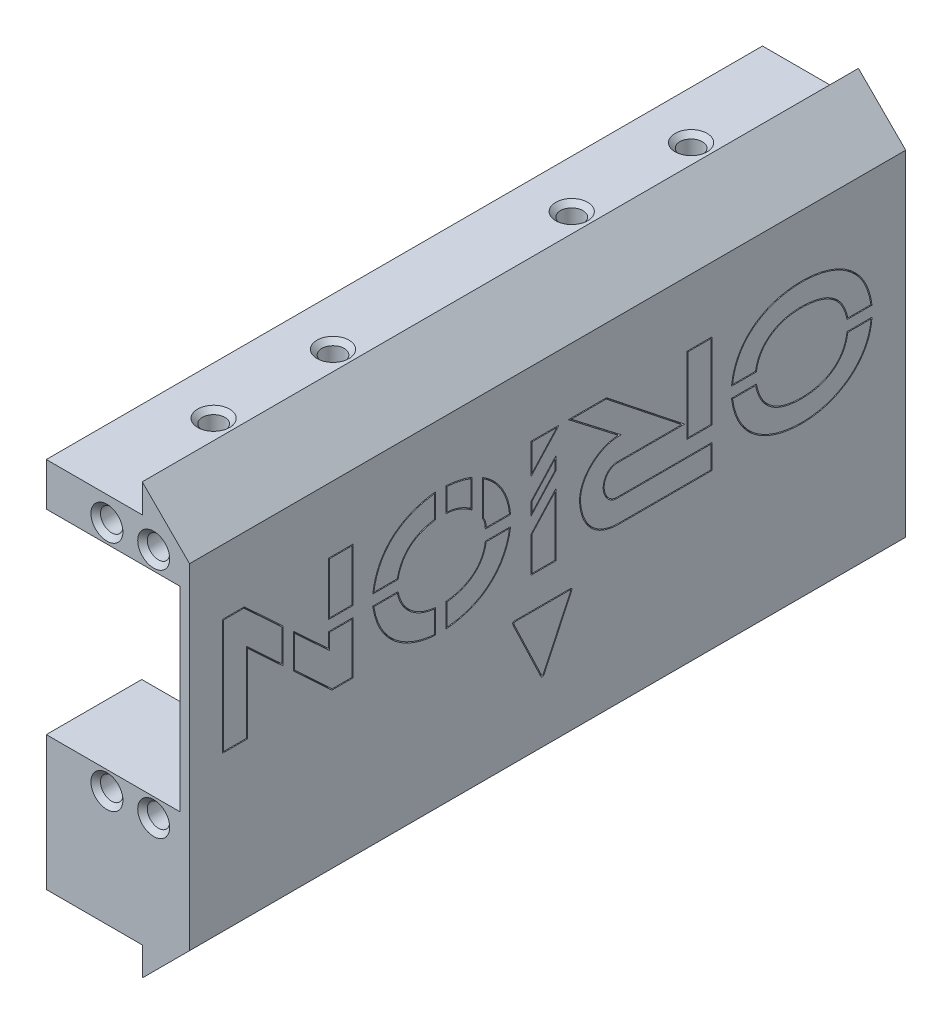
from build123d import *

# Parameters (mm, degrees)
BOSS_EXTRUDE1_DEPTH = 150
SKETCH2_R           = 2.35
CUT_EXTRUDE1_DEPTH  = 8
CUT_EXTRUDE2_START  = -8
SKETCH3_R           = 2.35
CUT_EXTRUDE2_DEPTH  = 8
CHAMFER1_SIZE       = 1
SKETCH4_W           = 20.1
SKETCH4_H           = 6
CUT_EXTRUDE3_DEPTH  = 158.321327226
CHAMFER2_SIZE       = 9.9
SKETCH5_R           = 2.35
CUT_EXTRUDE4_DEPTH  = 8
CHAMFER3_SIZE       = 1
SKETCH6_R           = 6.1
CUT_EXTRUDE5_DEPTH  = 3.2
SKETCH8_W           = 110
SKETCH8_H           = 21.9
CUT_EXTRUDE7_DEPTH  = 28
FILLET1_R           = 0.2
SKETCH9_W           = 80
SKETCH9_H           = 62.8
BOSS_EXTRUDE2_DEPTH = 1.5
SKETCH14_W          = 5.239877573
SKETCH14_H          = 15.985748595
SKETCH14_W_2        = 5.162010056
SKETCH14_H_2        = 11.128808668
CUT_EXTRUDE8_DEPTH  = 1
SKETCH15_W          = 4.762010056
SKETCH15_H          = 10.728808668
SKETCH15_W_2        = 4.839877573
SKETCH15_H_2        = 15.585748595
BOSS_EXTRUDE3_DEPTH = 1


with BuildPart() as part:
    # Sketch1 → Boss-Extrude1 (new body)
    with BuildSketch(Plane.XY):
        Polygon((-15, 45), (15, 45), (15, -45), (-15, -45), (-15, -10.9), (13, -10.9), (13, 30), (-15, 30), align=None)
    extrude(amount=BOSS_EXTRUDE1_DEPTH)

    # Sketch2 → Cut-Extrude1 (cut)
    with BuildSketch(Plane.XY.offset(150)):
        with Locations((7.5, 33.89)):
            Circle(SKETCH2_R)
        with Locations(Location((-2.3, 33.89, 0), (0, 0, 180))):
            Circle(SKETCH2_R)
        with Locations(Location((7.5, -14.79, 0), (0, 0, 180))):
            Circle(SKETCH2_R)
        with Locations((-2.3, -14.79)):
            Circle(SKETCH2_R)
    extrude(amount=-CUT_EXTRUDE1_DEPTH, mode=Mode.SUBTRACT)

    # Sketch3 → Cut-Extrude2 (cut)
    with BuildSketch(Plane(origin=(0, 0, 0), x_dir=(-1, 0, 0), z_dir=(0, 0, -1)).offset(CUT_EXTRUDE2_START)):
        with Locations(Location((-7.5, 33.89, 0), (0, 0, 180))):
            Circle(SKETCH3_R)
        with Locations((2.3, 33.89)):
            Circle(SKETCH3_R)
        with Locations((-7.5, -14.79)):
            Circle(SKETCH3_R)
        with Locations(Location((2.3, -14.79, 0), (0, 0, 180))):
            Circle(SKETCH3_R)
    extrude(amount=CUT_EXTRUDE2_DEPTH, mode=Mode.SUBTRACT)

    # Chamfer1
    chamfer1_edges = [part.edges().sort_by_distance(p)[0] for p in [
        (0.05, 33.89, 150),
        (9.85, -14.79, 150),
        (-4.65, -14.79, 150),
        (5.15, 33.89, 150),
        (0.05, 33.89, 0),
        (9.85, -14.79, 0),
        (-4.65, -14.79, 0),
        (5.15, 33.89, 0),
    ]]
    chamfer(chamfer1_edges, length=CHAMFER1_SIZE)

    # Sketch4 → Cut-Extrude3 (cut, through all)
    with BuildSketch(Plane.XY.offset(150)):
        with Locations((-4.95, -42)):
            Rectangle(SKETCH4_W, SKETCH4_H)
        with Locations((-4.95, 42)):
            Rectangle(SKETCH4_W, SKETCH4_H)
    extrude(amount=-CUT_EXTRUDE3_DEPTH, mode=Mode.SUBTRACT)

    # Chamfer2
    chamfer2_edges = [part.edges().sort_by_distance(p)[0] for p in [
        (15, -45, 75),
        (15, 45, 75),
    ]]
    chamfer(chamfer2_edges, length=CHAMFER2_SIZE - 0.0001)  # a hair under: the kernel refuses the full size

    # Sketch5 → Cut-Extrude4 (cut)
    with BuildSketch(Plane(origin=(0, 39, 0), x_dir=(1, 0, 0), z_dir=(0, 1, 0))):
        with Locations(Location((-4.95, -25, 0), (0, 0, 270))):
            Circle(SKETCH5_R)
        with Locations(Location((-4.95, -50, 0), (0, 0, 270))):
            Circle(SKETCH5_R)
        with Locations(Location((-4.95, -100, 0), (0, 0, 270))):
            Circle(SKETCH5_R)
        with Locations(Location((-4.95, -125, 0), (0, 0, 270))):
            Circle(SKETCH5_R)
    extrude(amount=-CUT_EXTRUDE4_DEPTH, mode=Mode.SUBTRACT)

    # Chamfer3
    chamfer3_edges = [part.edges().sort_by_distance(p)[0] for p in [
        (-4.95, 39, 22.65),
        (-4.95, 39, 47.65),
        (-4.95, 39, 97.65),
        (-4.95, 39, 122.65),
    ]]
    chamfer(chamfer3_edges, length=CHAMFER3_SIZE)

    # Sketch6 → Cut-Extrude5 (cut)
    with BuildSketch(Plane.XZ.offset(39)):
        with Locations(Location((-5, 59.666666667, 0), (0, 0, 270))):
            Circle(SKETCH6_R)
        with Locations(Location((-5, 90.333333333, 0), (0, 0, 270))):
            Circle(SKETCH6_R)
    extrude(amount=-CUT_EXTRUDE5_DEPTH, mode=Mode.SUBTRACT)

    # Sketch8 → Cut-Extrude7 (cut)
    with BuildSketch(Plane.ZY.offset(15)):
        with Locations((75, -21.85)):
            Rectangle(SKETCH8_W, SKETCH8_H)
    extrude(amount=-CUT_EXTRUDE7_DEPTH, mode=Mode.SUBTRACT)

    # Fillet1
    fillet1_edges = [part.edges().sort_by_distance(p)[0] for p in [
        (-5, -39, 65.766666667),
        (-5, -39, 96.433333333),
    ]]
    fillet(fillet1_edges, radius=FILLET1_R)

    # Sketch9 → Boss-Extrude2 (add)
    with BuildSketch(Plane.ZY.offset(-13)):
        with Locations((75, -1.4)):
            Rectangle(SKETCH9_W, SKETCH9_H)
    extrude(amount=BOSS_EXTRUDE2_DEPTH)

    # Sketch14 → Cut-Extrude8 (cut)
    with BuildSketch(Plane(origin=(15, 0, 0), x_dir=(0, 0, -1), z_dir=(1, 0, 0))):
        with BuildLine():
            add(Edge.make_bspline(
                [(-36.495605371, 10.527266051), (-35.606611421, 18.782508471), (-21.841632144, 25.659853111), (-8.055982471, 18.937904469), (-7.066085705, 10.527266051)],
                knots=[0, 0, 0, 0, 0.49729852, 1, 1, 1, 1], degree=3))
            Line((-36.495605371, 10.527266051), (-31.27212237, 10.527266051))
            add(Edge.make_bspline(
                [(-31.27212237, 10.527266051), (-30.782455511, 14.495178515), (-26.837087438, 17.539375238), (-16.967357317, 17.394766524), (-13.183729515, 15.184827603), (-12.288625681, 10.527266051)],
                knots=[0, 0, 0, 0, 0.449389601, 0.549389601, 1, 1, 1, 1], degree=3))
            Line((-12.288625681, 10.527266051), (-7.066085705, 10.527266051))
        make_face()
        with BuildLine():
            Line((-31.27212237, 8.332364301), (-36.495605371, 8.332364301))
            add(Edge.make_bspline(
                [(-36.495605371, 8.332364301), (-35.571612197, 0.731696062), (-28.935635191, -3.600460934), (-14.091021606, -3.709813454), (-7.404222627, 1.82979959), (-7.066018932, 8.332364301)],
                knots=[0, 0, 0, 0, 0.42989922, 0.52989922, 1, 1, 1, 1], degree=3))
            Line((-7.066018932, 8.332364301), (-12.288625681, 8.332364301))
            add(Edge.make_bspline(
                [(-31.27212237, 8.332364301), (-30.355266701, 3.299743765), (-26.238828233, 1.115812747), (-17.203156987, 1.102363999), (-12.890664932, 3.583772765), (-12.288625681, 8.332364301)],
                knots=[0, 0, 0, 0, 0.434183969, 0.534183969, 1, 1, 1, 1], degree=3))
        make_face()
        with BuildLine():
            Line((-60.095552509, -2.702507791), (-40.588788824, -2.702507791))
            Line((-40.588788824, -2.702507791), (-40.588788824, 2.374178356))
            Line((-40.588788824, 2.374178356), (-60.476186142, 2.374178356))
            add(Edge.make_bspline(
                [(-60.476186142, 2.374178356), (-62.206823572, 2.416470634), (-63.162487076, 4.31796462), (-63.178008942, 6.733553948), (-62.168545666, 8.508420898), (-60.465125431, 8.57296241)],
                knots=[0, 0, 0, 0, 0.456599796, 0.556599796, 1, 1, 1, 1], degree=3))
            Line((-60.465125431, 8.57296241), (-46.325984318, 8.57296241))
            Line((-46.325984318, 8.57296241), (-62.667828603, 21.532658645))
            Line((-62.667828603, 21.532658645), (-70.631904142, 21.532658645))
            Line((-70.631904142, 21.532658645), (-60.185427294, 13.471424046))
            add(Edge.make_bspline(
                [(-60.095552509, -2.702507791), (-65.209774447, -2.645365646), (-68.160158969, 1.409640322), (-68.503917635, 9.560837257), (-64.02396644, 13.443848795), (-60.185427294, 13.471424046)],
                knots=[0, 0, 0, 0, 0.45572746, 0.55572746, 1, 1, 1, 1], degree=3))
        make_face()
        with Locations((-43.229108326, 13.539784348)):
            Rectangle(SKETCH14_W, SKETCH14_H)
        Polygon((-78.523050455, -2.745537739), (-73.295745914, -2.745537739), (-73.295745914, 10.320552095), (-78.523050455, 4.612886686), align=None)
        Polygon((-78.523050455, 7.883656054), (-73.295745914, 13.591321464), (-73.295745914, 16.289231623), (-78.523050455, 10.581566213), align=None)
        Polygon((-72.612153323, 21.532658645), (-78.523050455, 21.532658645), (-78.523050455, 15.078582201), align=None)
        with BuildLine():
            add(Edge.make_bspline(
                [(-70.25277074, -9.305969017), (-69.877028749, -9.307242391), (-69.846303583, -9.553213605), (-70.029991998, -9.939892146)],
                knots=[0, 0, 0, 0, 1, 1, 1, 1], degree=3))
            Line((-70.25277074, -9.305969017), (-81.920970846, -9.305969017))
            add(Edge.make_bspline(
                [(-81.920970846, -9.305969017), (-82.475118437, -9.315272479), (-82.323170908, -9.769201843), (-82.155628449, -10.131704416)],
                knots=[0, 0, 0, 0, 1, 1, 1, 1], degree=3))
            Line((-82.155628449, -10.131704416), (-76.422444417, -22.127644697))
            add(Edge.make_bspline(
                [(-76.422444417, -22.127644697), (-76.264195462, -22.462370015), (-75.914336003, -22.457186236), (-75.759121828, -22.133083912)],
                knots=[0, 0, 0, 0, 1, 1, 1, 1], degree=3))
            Line((-75.759121828, -22.133083912), (-70.029991998, -9.939892146))
        make_face()
        with BuildLine():
            add(Edge.make_bspline(
                [(-82.757372043, 8.201337904), (-83.49122839, 2.269901705), (-87.84388843, -3.009701843), (-96.311482165, -3.611728777)],
                knots=[0, 0, 0, 0, 1, 1, 1, 1], degree=3))
            Line((-82.757372043, 8.201337904), (-88.047074311, 8.201337904))
            add(Edge.make_bspline(
                [(-88.047074311, 8.201337904), (-88.453054328, 4.67264198), (-91.167722243, 1.858145488), (-96.311482165, 1.395325588)],
                knots=[0, 0, 0, 0, 1, 1, 1, 1], degree=3))
            Line((-96.311482165, 1.395325588), (-96.311482165, -3.611728777))
        make_face()
        with BuildLine():
            add(Edge.make_bspline(
                [(-98.506396616, 1.395325588), (-101.94199152, 1.756063723), (-105.470077888, 3.743984793), (-106.321714617, 8.201337904)],
                knots=[0, 0, 0, 0, 1, 1, 1, 1], degree=3))
            Line((-106.321714617, 8.201337904), (-111.62972679, 8.201337904))
            add(Edge.make_bspline(
                [(-111.62972679, 8.201337904), (-110.498137645, 0.183158852), (-104.369151909, -3.238525948), (-98.506396616, -3.611728777)],
                knots=[0, 0, 0, 0, 1, 1, 1, 1], degree=3))
            Line((-98.506396616, -3.611728777), (-98.506396616, 1.395325588))
        make_face()
        with BuildLine():
            Line((-88.047074311, 10.403849977), (-82.757372043, 10.403849977))
            add(Edge.make_bspline(
                [(-82.757372043, 10.403849977), (-83.100984418, 14.653503397), (-85.370149664, 18.106707004), (-88.616757465, 20.047555791)],
                knots=[0, 0, 0, 0, 1, 1, 1, 1], degree=3))
            Line((-88.616757465, 20.047555791), (-88.616757465, 12.531774895))
            add(Edge.make_bspline(
                [(-88.047074311, 10.403849977), (-88.06976577, 11.148610746), (-88.165231263, 11.886276459), (-88.616757465, 12.531774895)],
                knots=[0, 0, 0, 0, 1, 1, 1, 1], degree=3))
        make_face()
        with BuildLine():
            add(Edge.make_bspline(
                [(-96.311482165, 17.295692442), (-94.353972983, 17.290642151), (-92.565150799, 16.51196585), (-90.806559935, 15.250541947)],
                knots=[0, 0, 0, 0, 1, 1, 1, 1], degree=3))
            Line((-90.806559935, 15.250541947), (-90.806559935, 21.165489187))
            add(Edge.make_bspline(
                [(-96.311482165, 22.378874758), (-94.377449092, 22.245646794), (-92.53966644, 21.891478925), (-90.806559935, 21.165489187)],
                knots=[0, 0, 0, 0, 1, 1, 1, 1], degree=3))
            Line((-96.311482165, 22.378874758), (-96.311482165, 17.295692442))
        make_face()
        with BuildLine():
            add(Edge.make_bspline(
                [(-98.506396616, 17.295692442), (-101.949125048, 16.835586591), (-105.438710607, 15.12335245), (-106.321714617, 10.403849977)],
                knots=[0, 0, 0, 0, 1, 1, 1, 1], degree=3))
            Line((-98.506396616, 17.295692442), (-98.506396616, 22.378874758))
            add(Edge.make_bspline(
                [(-111.62972679, 10.403849977), (-110.526812286, 18.675072508), (-104.390796669, 21.713247439), (-98.506396616, 22.378874758)],
                knots=[0, 0, 0, 0, 1, 1, 1, 1], degree=3))
            Line((-111.62972679, 10.403849977), (-106.321714617, 10.403849977))
        make_face()
        Polygon((-128.19910973, 4.711913352), (-120.184142907, -2.736667957), (-115.769421715, -2.736667957), (-115.769421715, 8.210802226), (-120.87783476, 8.210802226), (-120.87783476, 5.136134907), (-128.19910973, 11.940044781), align=None)
        with Locations((-118.326847214, 15.968254311)):
            Rectangle(SKETCH14_W_2, SKETCH14_H_2)
        Polygon((-138.521140018, 21.532658645), (-143.083148978, 21.532658645), (-143.083148978, -2.736667957), (-137.821722051, -2.736667957), (-137.821722051, 13.654534308), (-130.388868015, 6.746930213), (-130.388868015, 13.975061642), align=None)
    extrude(amount=-CUT_EXTRUDE8_DEPTH, mode=Mode.SUBTRACT)

    # Sketch15 → Boss-Extrude3 (add)
    with BuildSketch(Plane(origin=(14, 0, 0), x_dir=(0, 0, -1), z_dir=(1, 0, 0))):
        Polygon((-142.883148978, 21.332658645), (-142.883148978, -2.536667957), (-138.021722051, -2.536667957), (-138.021722051, 14.113433103), (-130.588868015, 7.205829008), (-130.588868015, 13.887896453), (-138.599725317, 21.332658645), align=None)
        with Locations((-118.326847214, 15.968254311)):
            Rectangle(SKETCH15_W, SKETCH15_H)
        Polygon((-115.969421715, 8.010802226), (-120.67783476, 8.010802226), (-120.67783476, 4.677236112), (-127.99910973, 11.481145986), (-127.99910973, 4.79907854), (-120.105557607, -2.536667957), (-115.969421715, -2.536667957), align=None)
        with BuildLine():
            Line((-82.985440944, 8.001337904), (-87.870738741, 8.001337904))
            add(Edge.make_bspline(
                [(-87.870738741, 8.001337904), (-87.988168444, 7.14678225), (-88.51271616, 5.457335402), (-89.875421983, 3.733863575), (-91.393375425, 2.630444065), (-92.742293601, 1.964288406), (-94.045785857, 1.556041453), (-95.186535659, 1.326999739), (-95.806165904, 1.244653787), (-96.111482165, 1.213581998)],
                knots=[0.016375682, 0.016375682, 0.016375682, 0.016375682, 0.25935345, 0.502331218, 0.623820102, 0.745308986, 0.86679787, 0.927542312, 0.988286754, 0.988286754, 0.988286754, 0.988286754], degree=3))
            Line((-96.111482165, 1.213581998), (-96.111482165, -3.395928095))
            add(Edge.make_bspline(
                [(-96.111482165, -3.395928095), (-95.616317089, -3.355731413), (-94.609804982, -3.237132274), (-92.769179574, -2.874051756), (-90.679796986, -2.189412563), (-88.537667082, -1.046649204), (-86.14538548, 0.849421654), (-84.012580408, 3.799385878), (-83.182950913, 6.588352523), (-82.985440944, 8.001337904)],
                knots=[0.008545665, 0.008545665, 0.008545665, 0.008545665, 0.069710684, 0.130875703, 0.253205741, 0.375535779, 0.497865818, 0.742525894, 0.987185971, 0.987185971, 0.987185971, 0.987185971], degree=3))
        make_face()
        with BuildLine():
            Line((-106.485739933, 8.001337904), (-111.397968369, 8.001337904))
            add(Edge.make_bspline(
                [(-111.397968369, 8.001337904), (-111.325902109, 7.535765598), (-111.138066229, 6.592208974), (-110.634049826, 4.888920018), (-109.764901931, 2.989191884), (-108.401348295, 1.090210075), (-106.229260156, -0.972283827), (-102.978026723, -2.71007082), (-100.137138506, -3.288020996), (-98.706396616, -3.397244752)],
                knots=[0.009639501, 0.009639501, 0.009639501, 0.009639501, 0.070772623, 0.131905745, 0.25417199, 0.376438235, 0.49870448, 0.74323697, 0.98776946, 0.98776946, 0.98776946, 0.98776946], degree=3))
            Line((-98.706396616, -3.397244752), (-98.706396616, 1.216670329))
            add(Edge.make_bspline(
                [(-98.706396616, 1.216670329), (-99.564775012, 1.320665336), (-101.257615127, 1.721853441), (-103.214777633, 2.783978589), (-104.544928768, 4.0081712), (-105.395114168, 5.121418693), (-105.954296645, 6.221214592), (-106.295110707, 7.199362479), (-106.430383108, 7.73536585), (-106.485739933, 8.001337904)],
                knots=[0.017064321, 0.017064321, 0.017064321, 0.017064321, 0.259801123, 0.502537924, 0.623906325, 0.745274726, 0.866643127, 0.927327328, 0.988011528, 0.988011528, 0.988011528, 0.988011528], degree=3))
        make_face()
        with BuildLine():
            Line((-111.399827671, 10.603849977), (-106.486510996, 10.603849977))
            add(Edge.make_bspline(
                [(-106.486510996, 10.603849977), (-106.429893605, 10.883366383), (-106.291373766, 11.449144654), (-105.946890445, 12.466409954), (-105.385015229, 13.594971273), (-104.533999021, 14.714827962), (-103.204403246, 15.924047549), (-101.253120825, 16.945227431), (-99.561166459, 17.345064086), (-98.706396616, 17.469691601)],
                knots=[0.011404175, 0.011404175, 0.011404175, 0.011404175, 0.072155909, 0.132907644, 0.254411114, 0.375914583, 0.497418053, 0.740424992, 0.98343193, 0.98343193, 0.98343193, 0.98343193], degree=3))
            Line((-98.706396616, 17.469691601), (-98.706396616, 22.153842934))
            add(Edge.make_bspline(
                [(-98.706396616, 22.153842934), (-100.144645896, 21.976465562), (-103.001373724, 21.34101895), (-106.25649924, 19.631094607), (-108.425538596, 17.595916907), (-109.78407548, 15.705682401), (-110.647358559, 13.789487469), (-111.145192744, 12.05417218), (-111.329876942, 11.081989507), (-111.399827671, 10.603849977)],
                knots=[0.01270983, 0.01270983, 0.01270983, 0.01270983, 0.257212065, 0.501714299, 0.623965416, 0.746216533, 0.86846765, 0.929593209, 0.990718767, 0.990718767, 0.990718767, 0.990718767], degree=3))
        make_face()
        with BuildLine():
            Line((-96.111482165, 22.163678225), (-96.111482165, 17.492563999))
            add(Edge.make_bspline(
                [(-96.111482165, 17.492563999), (-95.663305294, 17.479657655), (-94.76576637, 17.372676682), (-93.478249724, 16.990713743), (-92.231613141, 16.416201609), (-91.402008639, 15.904619623), (-91.006559935, 15.634677041)],
                knots=[0.033170497, 0.033170497, 0.033170497, 0.033170497, 0.260073814, 0.486977131, 0.713880449, 0.940783766, 0.940783766, 0.940783766, 0.940783766], degree=3))
            Line((-91.006559935, 15.634677041), (-91.006559935, 21.031728857))
            add(Edge.make_bspline(
                [(-91.006559935, 21.031728857), (-91.407355889, 21.195055992), (-92.224957548, 21.483681194), (-93.483828518, 21.807202627), (-94.775296688, 22.034180713), (-95.667446643, 22.129138994), (-96.111482165, 22.163678225)],
                knots=[0.02391569, 0.02391569, 0.02391569, 0.02391569, 0.258633652, 0.493351613, 0.728069575, 0.962787537, 0.962787537, 0.962787537, 0.962787537], degree=3))
        make_face()
        with BuildLine():
            Line((-87.854876732, 10.603849977), (-82.975943861, 10.603849977))
            add(Edge.make_bspline(
                [(-82.975943861, 10.603849977), (-83.023113942, 11.089821278), (-83.173405279, 12.068099633), (-83.670623999, 13.893365991), (-84.644044443, 15.979999873), (-86.295968763, 18.094482391), (-87.674585821, 19.213849503), (-88.416757465, 19.688688509)],
                knots=[0.017259236, 0.017259236, 0.017259236, 0.017259236, 0.136113012, 0.254966788, 0.492674339, 0.730381891, 0.968089442, 0.968089442, 0.968089442, 0.968089442], degree=3))
            Line((-88.416757465, 19.688688509), (-88.416757465, 12.593548637))
            add(Edge.make_bspline(
                [(-88.416757465, 12.593548637), (-88.316145418, 12.442723493), (-88.141608397, 12.115743611), (-87.981056825, 11.620027832), (-87.890021805, 11.111829351), (-87.863363832, 10.773639057), (-87.854876732, 10.603849977)],
                knots=[0.025322901, 0.025322901, 0.025322901, 0.025322901, 0.24770771, 0.470092519, 0.692477327, 0.914862136, 0.914862136, 0.914862136, 0.914862136], degree=3))
        make_face()
        Polygon((-78.323050455, 15.593084989), (-73.066523087, 21.332658645), (-78.323050455, 21.332658645), align=None)
        Polygon((-78.323050455, 8.398158842), (-73.495745914, 13.669066426), (-73.495745914, 15.774728835), (-78.323050455, 10.503821251), align=None)
        Polygon((-73.495745914, 9.806049307), (-78.323050455, 4.535141723), (-78.323050455, -2.545537739), (-73.495745914, -2.545537739), align=None)
        with BuildLine():
            Line((-40.788788824, -2.502507791), (-40.788788824, 2.174178356))
            Line((-40.788788824, 2.174178356), (-60.478629517, 2.174178356))
            add(Edge.make_bspline(
                [(-60.478629517, 2.174178356), (-60.717429585, 2.180014009), (-61.211534996, 2.253234298), (-62.007569956, 2.607034328), (-62.748583315, 3.346875), (-63.240115263, 4.453972731), (-63.41442439, 5.491751805), (-63.272109269, 6.509859685), (-62.773435876, 7.600732008), (-62.017537342, 8.331143497), (-61.209649773, 8.685842714), (-60.710625122, 8.763804092), (-60.468913009, 8.77296241)],
                knots=[-0.000214817, -0.000214817, -0.000214817, -0.000214817, 0.062319134, 0.124853085, 0.249920987, 0.374988889, 0.500056791, 0.625124693, 0.750192596, 0.875260498, 0.937794449, 1.0003284, 1.0003284, 1.0003284, 1.0003284], degree=3))
            Line((-60.468913009, 8.77296241), (-46.900052219, 8.77296241))
            Line((-46.900052219, 8.77296241), (-62.737506771, 21.332658645))
            Line((-62.737506771, 21.332658645), (-70.045352748, 21.332658645))
            Line((-70.045352748, 21.332658645), (-59.604279353, 13.275593729))
            add(Edge.make_bspline(
                [(-59.604279353, 13.275593729), (-59.877894233, 13.273628138), (-60.43102263, 13.280488295), (-61.489759409, 13.173987249), (-63.316989081, 12.680483704), (-65.662303787, 11.219553996), (-67.309963498, 9.076663917), (-68.00614328, 7.159869976), (-68.156335085, 5.669736627), (-67.997745612, 4.149971847), (-67.630020964, 2.673497517), (-67.032237985, 1.293181271), (-66.195191376, 0.055376898), (-65.104914513, -0.99436357), (-63.748140829, -1.812155293), (-62.372164071, -2.262406851), (-61.130655901, -2.458959449), (-60.434050736, -2.498680842), (-60.09443049, -2.502507791)],
                knots=[-0.02236526, -0.02236526, -0.02236526, -0.02236526, 0.009582604, 0.041530468, 0.105426196, 0.233217652, 0.361009109, 0.424904837, 0.488800565, 0.552696293, 0.616592021, 0.680487749, 0.744383477, 0.808279205, 0.872174933, 0.936070661, 0.968018525, 0.999966389, 0.999966389, 0.999966389, 0.999966389], degree=3))
            Line((-60.09443049, -2.502507791), (-40.788788824, -2.502507791))
        make_face()
        with Locations((-43.229108326, 13.539784348)):
            Rectangle(SKETCH15_W_2, SKETCH15_H_2)
        with BuildLine():
            Line((-36.271326188, 10.727266051), (-31.44708417, 10.727266051))
            add(Edge.make_bspline(
                [(-31.44708417, 10.727266051), (-31.369617813, 11.262076268), (-31.100378969, 12.338040927), (-30.185844123, 14.184893922), (-28.389799172, 16.031596407), (-25.928824056, 17.154059031), (-23.677576946, 17.593186066), (-21.867593385, 17.678359299), (-20.075659748, 17.564309929), (-17.864399678, 17.195244868), (-15.927388588, 16.439163659), (-14.347848524, 15.200534338), (-13.364990604, 14.011380791), (-12.730369954, 12.784329509), (-12.344177154, 11.665459905), (-12.188310905, 11.037098603), (-12.124510079, 10.727266051)],
                knots=[0.006503148, 0.006503148, 0.006503148, 0.006503148, 0.068272612, 0.130042075, 0.253581001, 0.377119928, 0.438889391, 0.500658854, 0.562428317, 0.624197781, 0.747736707, 0.80950617, 0.871275634, 0.933045097, 0.963929828, 0.99481456, 0.99481456, 0.99481456, 0.99481456], degree=3))
            Line((-12.124510079, 10.727266051), (-7.292572578, 10.727266051))
            add(Edge.make_bspline(
                [(-7.292572578, 10.727266051), (-7.357259702, 11.218119602), (-7.537645384, 12.214488135), (-8.055701094, 14.001527072), (-8.99314283, 15.980047596), (-10.51134708, 17.930189521), (-12.978033223, 20.006890059), (-16.733878556, 21.660554493), (-21.796933262, 22.267045498), (-26.870696601, 21.632108901), (-30.636871913, 19.966338683), (-33.103183887, 17.889479075), (-34.614523698, 15.945251291), (-35.538987918, 13.97754062), (-36.041523551, 12.202795307), (-36.211890246, 11.214190884), (-36.271326188, 10.727266051)],
                knots=[0.004529657, 0.004529657, 0.004529657, 0.004529657, 0.035496645, 0.066463632, 0.128397608, 0.190331584, 0.252265559, 0.37613351, 0.500001462, 0.623869413, 0.747737364, 0.80967134, 0.871605315, 0.933539291, 0.964506279, 0.995473267, 0.995473267, 0.995473267, 0.995473267], degree=3))
        make_face()
        with BuildLine():
            Line((-31.43791012, 8.132364301), (-36.268354424, 8.132364301))
            add(Edge.make_bspline(
                [(-36.268354424, 8.132364301), (-36.198586222, 7.614390974), (-36.005811206, 6.561535349), (-35.459097668, 4.684383654), (-34.475958852, 2.61957367), (-32.887037113, 0.607416692), (-30.948623281, -0.977679162), (-28.72179985, -2.155939826), (-26.269372569, -2.94908944), (-23.654832143, -3.377904428), (-20.046199767, -3.48994759), (-15.730583183, -2.656443177), (-12.124003376, -0.63619725), (-9.864522805, 1.576580155), (-8.537447441, 3.5089122), (-7.780167448, 5.329131951), (-7.410227958, 6.89171484), (-7.307354569, 7.720661329), (-7.278570948, 8.132364301)],
                knots=[0.004297131, 0.004297131, 0.004297131, 0.004297131, 0.035251196, 0.066205261, 0.128113392, 0.190021523, 0.251929654, 0.313837784, 0.375745915, 0.437654046, 0.499562177, 0.623378438, 0.7471947, 0.80910283, 0.871010961, 0.932919092, 0.963873157, 0.994827223, 0.994827223, 0.994827223, 0.994827223], degree=3))
            Line((-7.278570948, 8.132364301), (-12.113856404, 8.132364301))
            add(Edge.make_bspline(
                [(-12.113856404, 8.132364301), (-12.15809854, 7.824585607), (-12.277516044, 7.200592904), (-12.611749704, 6.077556442), (-13.209100058, 4.831026596), (-14.174927029, 3.60115319), (-15.746185328, 2.293817057), (-18.138800152, 1.252069251), (-21.438013504, 0.818939168), (-24.803802267, 1.073811453), (-27.307180652, 1.967705785), (-29.00322801, 3.243884127), (-30.077467867, 4.507284387), (-30.778031666, 5.844704831), (-31.201483695, 7.082018023), (-31.370307995, 7.786155406), (-31.43791012, 8.132364301)],
                knots=[0.005648175, 0.005648175, 0.005648175, 0.005648175, 0.036575359, 0.067502543, 0.12935691, 0.191211277, 0.253065645, 0.37677438, 0.500483114, 0.624191849, 0.747900584, 0.809754951, 0.871609318, 0.933463686, 0.96439087, 0.995318053, 0.995318053, 0.995318053, 0.995318053], degree=3))
        make_face()
        with BuildLine():
            Line((-75.940136113, -22.048031995), (-70.211006283, -9.854840229))
            add(Edge.make_bspline(
                [(-70.25277074, -9.505969017), (-70.065153582, -9.507902976), (-70.116183544, -9.639173005), (-70.211006283, -9.854840229)],
                knots=[0, 0, 0, 0, 1, 1, 1, 1], degree=3))
            Line((-70.25277074, -9.505969017), (-81.920970846, -9.505969017))
            add(Edge.make_bspline(
                [(-81.920970846, -9.505969017), (-82.150244248, -9.50879004), (-82.068232614, -9.823908361), (-81.975178163, -10.045462348)],
                knots=[0, 0, 0, 0, 1, 1, 1, 1], degree=3))
            Line((-81.975178163, -10.045462348), (-76.241994131, -22.041402629))
            add(Edge.make_bspline(
                [(-76.241994131, -22.041402629), (-76.173396953, -22.166689157), (-76.020544128, -22.173945907), (-75.940136113, -22.048031995)],
                knots=[0, 0, 0, 0, 1, 1, 1, 1], degree=3))
        make_face()
    extrude(amount=BOSS_EXTRUDE3_DEPTH)


solid = part.part
